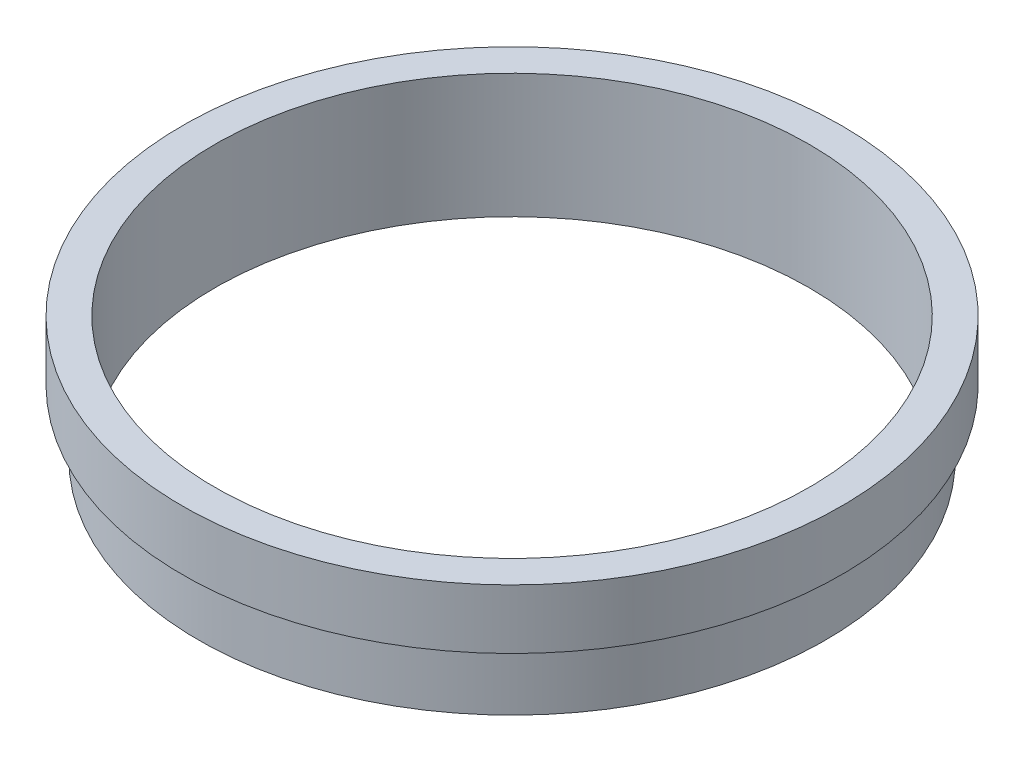
from build123d import *


with BuildPart() as part:
    # Sketch1 → Revolve1 (revolve)
    with BuildSketch(Plane.XY):
        Polygon((27.5, 11.5), (27.5, 0), (29, 0), (29, 6), (30.5, 6), (30.5, 11.5), align=None)
    revolve(axis=Axis((0, 0, 0), (0, 1, 0)))


solid = part.part
